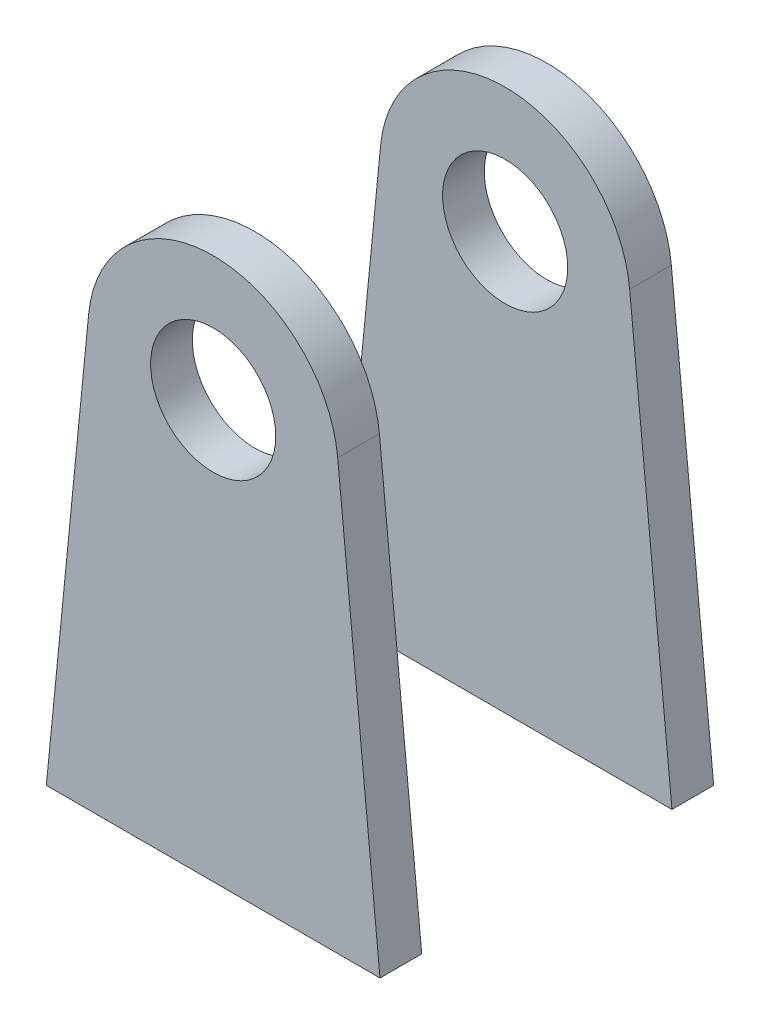
from build123d import *

# Parameters (mm, degrees)
BOSS_EXTRUDE1_START = 12.7
SKETCH1_R           = 4.7625
BOSS_EXTRUDE1_DEPTH = 3.175
BOSS_EXTRUDE2_START = -12.7
SKETCH1_4_R         = 4.7625
BOSS_EXTRUDE2_DEPTH = 3.175


with BuildPart() as part:
    # Sketch1 → Boss-Extrude1 (new body)
    with BuildSketch(Plane.XY.offset(BOSS_EXTRUDE1_START)):
        with BuildLine():
            ThreePointArc((9.479083286, 0.934133315), (0, 9.525), (-9.479083286, 0.934133315))
            Line((-9.479083286, 0.934133315), (-12.7, -31.75))
            Line((-12.7, -31.75), (12.7, -31.75))
            Line((12.7, -31.75), (9.479083286, 0.934133315))
        make_face()
        Circle(SKETCH1_R, mode=Mode.SUBTRACT)
    extrude(amount=-BOSS_EXTRUDE1_DEPTH)


with BuildPart() as body_2:
    # Sketch1<4> → Boss-Extrude2 (new body)
    with BuildSketch(Plane.XY.offset(BOSS_EXTRUDE2_START)):
        with BuildLine():
            ThreePointArc((9.479083286, 0.934133315), (0, 9.525), (-9.479083286, 0.934133315))
            Line((-9.479083286, 0.934133315), (-12.7, -31.75))
            Line((-12.7, -31.75), (12.7, -31.75))
            Line((12.7, -31.75), (9.479083286, 0.934133315))
        make_face()
        Circle(SKETCH1_4_R, mode=Mode.SUBTRACT)
    extrude(amount=BOSS_EXTRUDE2_DEPTH)


solid = Compound([part.part, body_2.part])
